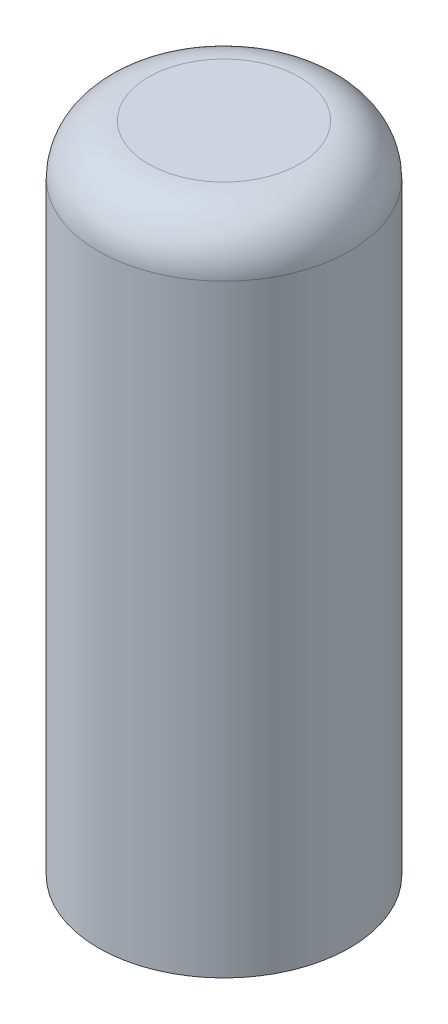
from build123d import *

# Parameters (mm, degrees)
SKETCH2_R           = 2.5
SKETCH2_W           = 1.15
SKETCH2_H           = 1.2
BOSS_EXTRUDE1_DEPTH = 6.5
FILLET1_R           = 1
SKETCH3_W           = 1.15
SKETCH3_H           = 1.2
BOSS_EXTRUDE5_DEPTH = 1


with BuildPart() as part:
    # Sketch2 → Boss-Extrude1 (new, symmetric)
    with BuildSketch(Plane(origin=(0, 0, 0), x_dir=(1, 0, 0), z_dir=(0, 1, 0))):
        Circle(SKETCH2_R)
        Rectangle(SKETCH2_W, SKETCH2_H, mode=Mode.SUBTRACT)
    extrude(amount=BOSS_EXTRUDE1_DEPTH, both=True)

    # Fillet1
    fillet1_edges = [part.edges().sort_by_distance(p)[0] for p in [
        (-2.5, 6.5, 0),
    ]]
    fillet(fillet1_edges, radius=FILLET1_R)

    # Sketch3 → Boss-Extrude5 (add)
    with BuildSketch(Plane(origin=(0, 6.5, 0), x_dir=(1, 0, 0), z_dir=(0, 1, 0))):
        Rectangle(SKETCH3_W, SKETCH3_H)
    extrude(amount=-BOSS_EXTRUDE5_DEPTH)


solid = part.part
